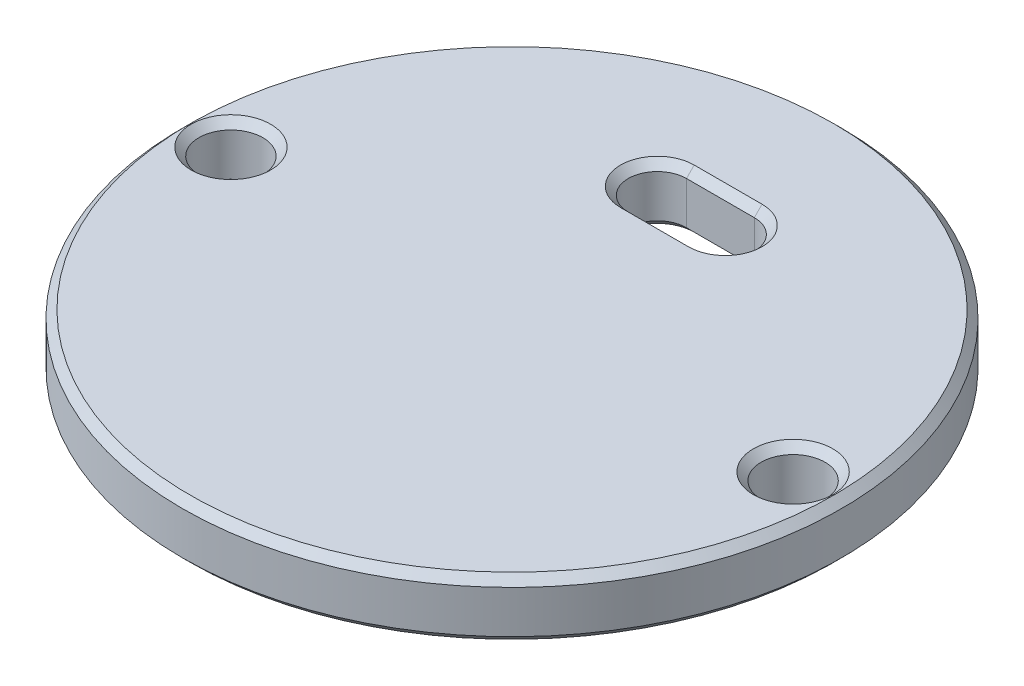
from build123d import *

# Parameters (mm, degrees)
SKETCH1_R           = 17
SKETCH1_R_2         = 1.65
BOSS_EXTRUDE1_DEPTH = 3
CHAMFER1_SIZE       = 0.4


with BuildPart() as part:
    # Sketch1 → Boss-Extrude1 (new body)
    with BuildSketch(Plane(origin=(0, 0, 0), x_dir=(1, 0, 0), z_dir=(0, 1, 0))):
        Circle(SKETCH1_R)
        with Locations((-14.5, 0)):
            Circle(SKETCH1_R_2, mode=Mode.SUBTRACT)
        with Locations((14.5, 0)):
            Circle(SKETCH1_R_2, mode=Mode.SUBTRACT)
        with BuildLine():
            Line((-1.75, 7.75), (1.75, 7.75))
            ThreePointArc((1.75, 7.75), (3.25, 9.25), (1.75, 10.75))
            Line((1.75, 10.75), (-1.75, 10.75))
            ThreePointArc((-1.75, 10.75), (-3.25, 9.25), (-1.75, 7.75))
        make_face(mode=Mode.SUBTRACT)
    extrude(amount=BOSS_EXTRUDE1_DEPTH)

    # Chamfer1
    chamfer1_edges = [part.edges().sort_by_distance(p)[0] for p in [
        (12.85, 0, 0),
        (12.85, 3, 0),
        (0, 3, -7.75),
        (3.25, 3, -9.25),
        (-3.25, 3, -9.25),
        (0, 3, -10.75),
        (0, 0, -7.75),
        (3.25, 0, -9.25),
        (-3.25, 0, -9.25),
        (0, 0, -10.75),
        (-16.15, 0, 0),
        (-16.15, 3, 0),
        (-17, 0, 0),
        (-17, 3, 0),
    ]]
    chamfer(chamfer1_edges, length=CHAMFER1_SIZE)


solid = part.part
